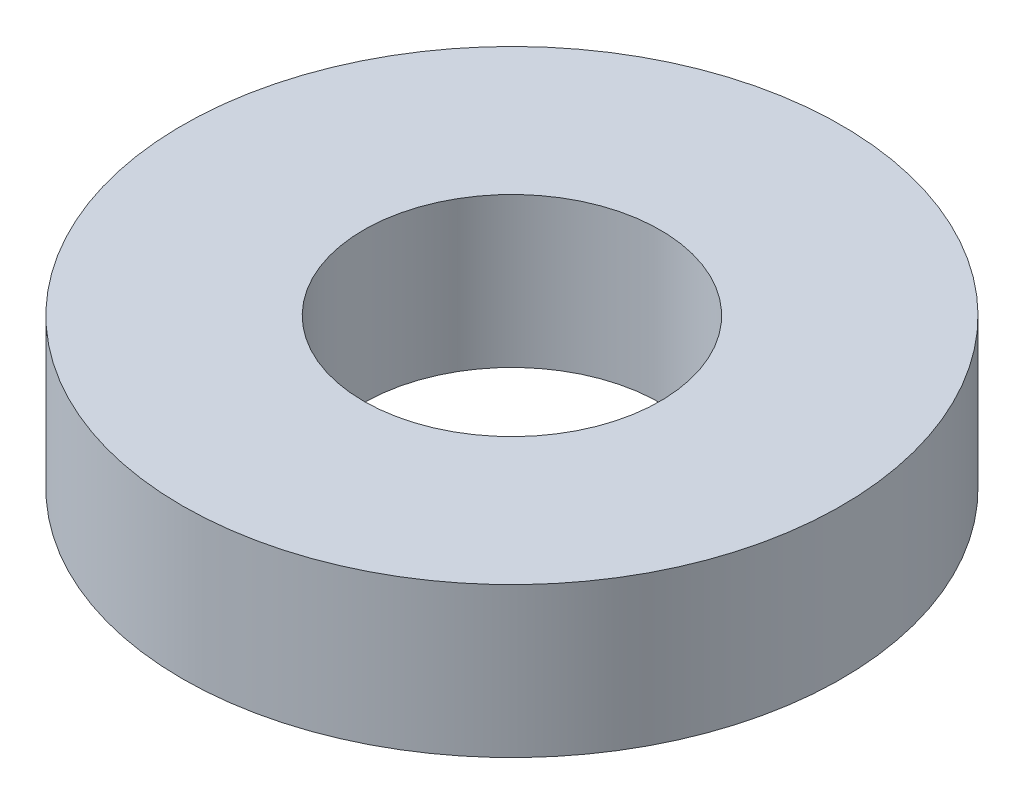
from build123d import *

# Parameters (mm, degrees)
SKETCH1_R           = 11
SKETCH1_R_2         = 4.95
BOSS_EXTRUDE1_DEPTH = 5


with BuildPart() as part:
    # Sketch1 → Boss-Extrude1 (new body)
    with BuildSketch(Plane(origin=(0, 0, 0), x_dir=(1, 0, 0), z_dir=(0, 1, 0))):
        Circle(SKETCH1_R)
        Circle(SKETCH1_R_2, mode=Mode.SUBTRACT)
    extrude(amount=BOSS_EXTRUDE1_DEPTH)


solid = part.part
